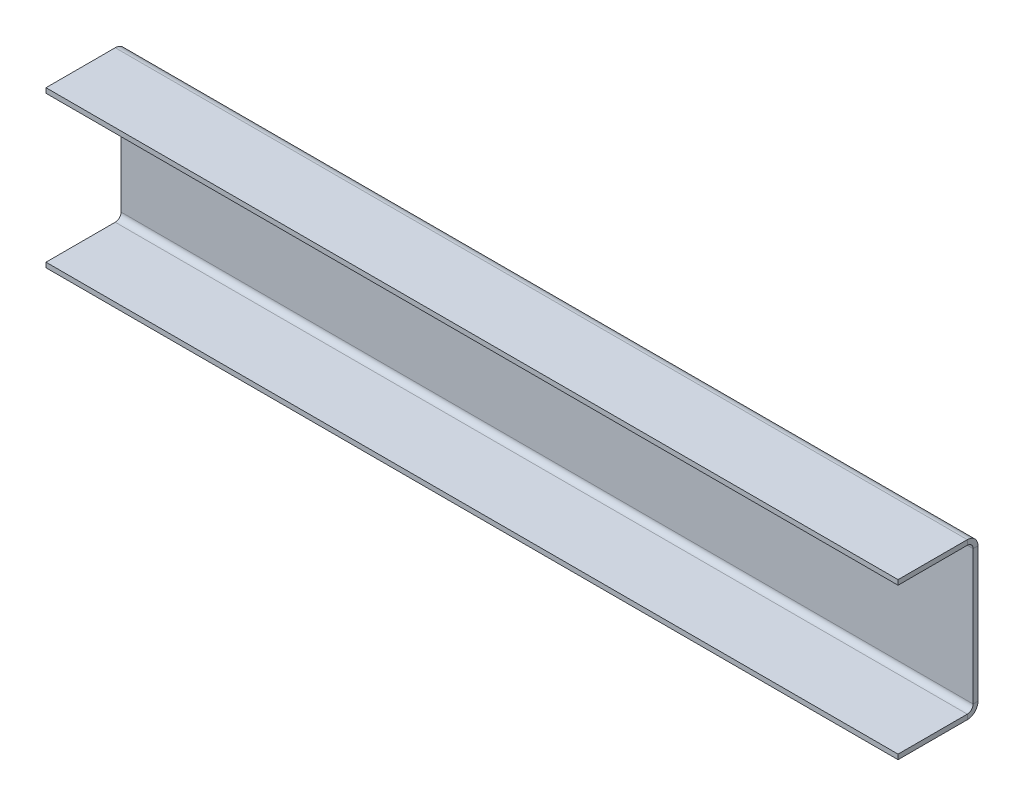
from build123d import *

# Parameters (mm, degrees)
SKETCH1_W                      = 437
SKETCH1_H                      = 80
BASE_FLANGE1_DEPTH             = 2.5
EDGE_FLANGE1_STRIP_W           = 16
EDGE_FLANGE1_STRIP_H           = 2.5
EDGE_FLANGE1_STRIP_CUT_DEPTH   = 437
EDGE_FLANGE1_STRIP_2_W         = 16
EDGE_FLANGE1_STRIP_2_H         = 2.5
EDGE_FLANGE1_STRIP_CUT_2_DEPTH = 437
EDGE_FLANGE1_DEPTH             = 437
EDGE_FLANGE1_BEND_DEPTH        = 437


# Sheet-metal steps are written as plain solids
with BuildPart() as part:
    # Sketch1 → Base-Flange1 (new body)
    with BuildSketch(Plane.XY):
        Rectangle(SKETCH1_W, SKETCH1_H)
    extrude(amount=-BASE_FLANGE1_DEPTH)

    # Edge-Flange1 strip (across the edge) → Edge-Flange1 strip cut (cut)
    with BuildSketch(Plane(origin=(218.5, 40, 0), x_dir=(0, -1, 0), z_dir=(-1, 0, 0))):
        with Locations((-2.5, -1.25)):
            Rectangle(EDGE_FLANGE1_STRIP_W, EDGE_FLANGE1_STRIP_H)
    extrude(amount=EDGE_FLANGE1_STRIP_CUT_DEPTH, mode=Mode.SUBTRACT)

    # Edge-Flange1 strip 2 (across the edge) → Edge-Flange1 strip cut 2 (cut)
    with BuildSketch(Plane(origin=(-218.5, -40, 0), x_dir=(0, 1, 0), z_dir=(1, 0, 0))):
        with Locations((-2.5, -1.25)):
            Rectangle(EDGE_FLANGE1_STRIP_2_W, EDGE_FLANGE1_STRIP_2_H)
    extrude(amount=EDGE_FLANGE1_STRIP_CUT_2_DEPTH, mode=Mode.SUBTRACT)

    # Edge-Flange1 section (across the edge) → Edge-Flange1 (add)
    with BuildSketch(Plane(origin=(218.5, 40, 0), x_dir=(0, -1, 0), z_dir=(-1, 0, 0))):
        with BuildLine():
            Line((0, 3), (0, 38.5))
            Line((0, 38.5), (2.5, 38.5))
            Line((2.5, 38.5), (2.5, 3))
            ThreePointArc((2.5, 3), (3.378679656, 0.878679656), (5.5, 0))
            Line((5.5, 0), (5.5, -2.5))
            ThreePointArc((5.5, -2.5), (1.610912703, -0.889087297), (0, 3))
        make_face()
    extrude(amount=EDGE_FLANGE1_DEPTH)

    # Edge-Flange1 section 2 (across the edge) → Edge-Flange1 bend (add)
    with BuildSketch(Plane(origin=(-218.5, -40, 0), x_dir=(0, 1, 0), z_dir=(1, 0, 0))):
        with BuildLine():
            Line((0, 3), (0, 38.5))
            Line((0, 38.5), (2.5, 38.5))
            Line((2.5, 38.5), (2.5, 3))
            ThreePointArc((2.5, 3), (3.378679656, 0.878679656), (5.5, 0))
            Line((5.5, 0), (5.5, -2.5))
            ThreePointArc((5.5, -2.5), (1.610912703, -0.889087297), (0, 3))
        make_face()
    extrude(amount=EDGE_FLANGE1_BEND_DEPTH)


solid = part.part
